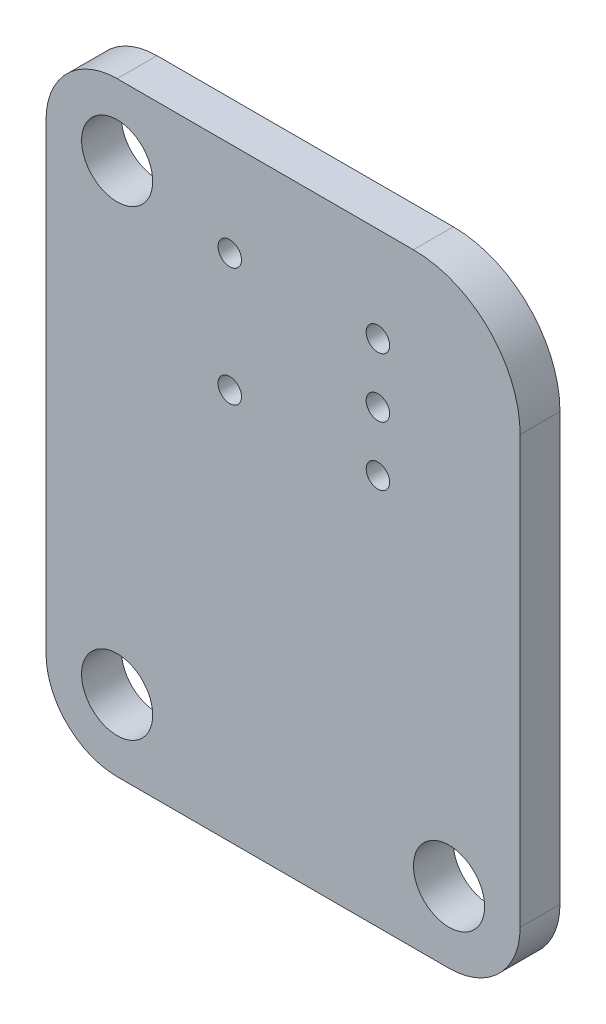
from build123d import *

# Parameters (mm, degrees)
BOARD_DEPTH        = 1.68
SKETCH2_R          = 1.5
SKETCH2_R_2        = 0.4953
PLATED_HOLES_DEPTH = 120.361174592


with BuildPart() as part:
    # Sketch1 → BOARD (new body)
    with BuildSketch(Plane.XY.offset(-4.7)):
        with BuildLine():
            Line((100, 42.5), (100, 60.5))
            ThreePointArc((100, 60.5), (98.681980515, 63.681980515), (95.5, 65))
            Line((95.5, 65), (83, 65))
            ThreePointArc((83, 65), (80.878679656, 64.121320344), (80, 62))
            Line((80, 62), (80, 42.5))
            ThreePointArc((80, 42.5), (80.878679656, 40.378679656), (83, 39.5))
            Line((83, 39.5), (97, 39.5))
            ThreePointArc((97, 39.5), (99.121320344, 40.378679656), (100, 42.5))
        make_face()
    extrude(amount=BOARD_DEPTH)

    # Sketch2 → PLATED HOLES (cut, through all)
    with BuildSketch(Plane.XY):
        with Locations((83, 42.5)):
            Circle(SKETCH2_R)
        with Locations((97, 42.5)):
            Circle(SKETCH2_R)
        with Locations((97, 35.5)):
            Circle(SKETCH2_R)
        with Locations((83, 62)):
            Circle(SKETCH2_R)
        with Locations((87.749999989, 55.999999989)):
            Circle(SKETCH2_R_2)
        with Locations((87.749999989, 60.999999996)):
            Circle(SKETCH2_R_2)
        with Locations((94.000000011, 58.499999992)):
            Circle(SKETCH2_R_2)
        with Locations((94.000000011, 55.999999989)):
            Circle(SKETCH2_R_2)
        with Locations((94.000000011, 60.999999996)):
            Circle(SKETCH2_R_2)
    extrude(amount=-PLATED_HOLES_DEPTH, mode=Mode.SUBTRACT)


solid = part.part
